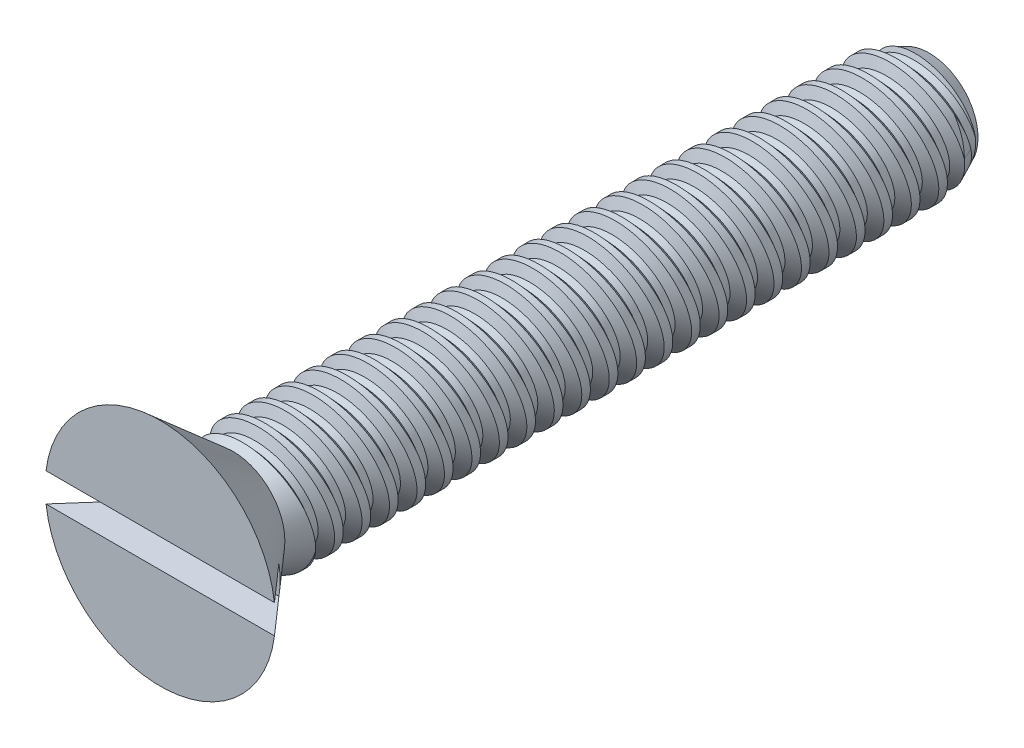
from build123d import *

# Parameters (mm, degrees)
SKETCH1_R          = 3.3274
EXTRUDE3_DEPTH     = 2.1082
SKETCH4_W          = 20.1168
SKETCH4_H          = 1.7526
LPATTERN2_COUNT    = 25
LPATTERN2_PITCH    = 0.79375
SKETCH15_W         = 6.6548
SKETCH15_H         = 0.83185
CUT_EXTRUDE5_DEPTH = 1.0541


with BuildPart() as part:
    # Sketch1 → Extrude3 (new body)
    with BuildSketch(Plane.XY):
        Circle(SKETCH1_R)
    extrude(amount=EXTRUDE3_DEPTH)

    # Sketch11 → Cut-Revolve3 (revolve, cut)
    with BuildSketch(Plane(origin=(0, 0, 0), x_dir=(0, 0, -1), z_dir=(1, 0, 0)), mode=Mode.PRIVATE) as cut_revolve3_sk:
        Polygon((0, 1.494769699), (-2.1082, 3.3274), (0, 3.3274), align=None)
    revolve(cut_revolve3_sk.sketch.rotate(Axis((0, 0, -0.441444004), (0, 0, 1)), 125.594493441), axis=Axis((0, 0, -0.441444004), (0, 0, 1)), mode=Mode.SUBTRACT)

    # Sketch4 → Revolve1 (revolve)
    with BuildSketch(Plane(origin=(0, 0, 0), x_dir=(0, 0, -1), z_dir=(1, 0, 0)), mode=Mode.PRIVATE) as revolve1_sk:
        with Locations((10.0584, 0.8763)):
            Rectangle(SKETCH4_W, SKETCH4_H)
    revolve(revolve1_sk.sketch.rotate(Axis((0, 0, -20.1168), (0, 0, -1)), 234.405506559), axis=Axis((0, 0, -20.1168), (0, 0, -1)))

    # Sketch5 → Cut-Revolve1 (revolve, cut)
    with BuildSketch(Plane(origin=(0, 0, 0), x_dir=(0, 0, -1), z_dir=(1, 0, 0)), mode=Mode.PRIVATE) as cut_revolve1_sk:
        Polygon((0.096768654, 1.774513192), (0.433577192, 1.410275607), (0.6271145, 1.454101991), (0.774149232, 1.927905533), align=None)
    cut_revolve1 = revolve(cut_revolve1_sk.sketch.rotate(Axis((0, -0.193538035, 0), (0, 0.22085736379913876, -0.9753061185369929)), 180), axis=Axis((0, -0.193538035, 0), (0, 0.22085736379913876, -0.9753061185369929)), mode=Mode.SUBTRACT)

    # Sketch13 → Cut-Revolve4 (revolve, cut)
    with BuildSketch(Plane(origin=(0, 0, 0), x_dir=(0, 0, -1), z_dir=(1, 0, 0)), mode=Mode.PRIVATE) as cut_revolve4_sk:
        Polygon((20.1168, 1.410275607), (19.382682971, 1.7526), (20.1168, 1.7526), align=None)
    revolve(cut_revolve4_sk.sketch.rotate(Axis((0, 0, 0), (0, 0, -1)), 234.405506559), axis=Axis((0, 0, 0), (0, 0, -1)), mode=Mode.SUBTRACT)

    # Sketch16 → Cut-Revolve5 (revolve, cut)
    with BuildSketch(Plane(origin=(0, 0, 0), x_dir=(0, 0, -1), z_dir=(1, 0, 0)), mode=Mode.PRIVATE) as cut_revolve5_sk:
        Polygon((0, 1.494769699), (0.708382929, 1.7526), (0, 1.7526), align=None)
    revolve(cut_revolve5_sk.sketch.rotate(Axis((0, 0, 0), (0, 0, -1)), 234.405506559), axis=Axis((0, 0, 0), (0, 0, -1)), mode=Mode.SUBTRACT)

    # LPattern2: Cut-Revolve1 ×25
    with Locations(*[(0, 0, -i * LPATTERN2_PITCH) for i in range(1, LPATTERN2_COUNT)]):
        add(cut_revolve1, mode=Mode.SUBTRACT)

    # Sketch15 → Cut-Extrude5 (cut)
    with BuildSketch(Plane.XY.offset(2.1082)):
        Rectangle(SKETCH15_W, SKETCH15_H)
    extrude(amount=-CUT_EXTRUDE5_DEPTH, mode=Mode.SUBTRACT)


solid = part.part
